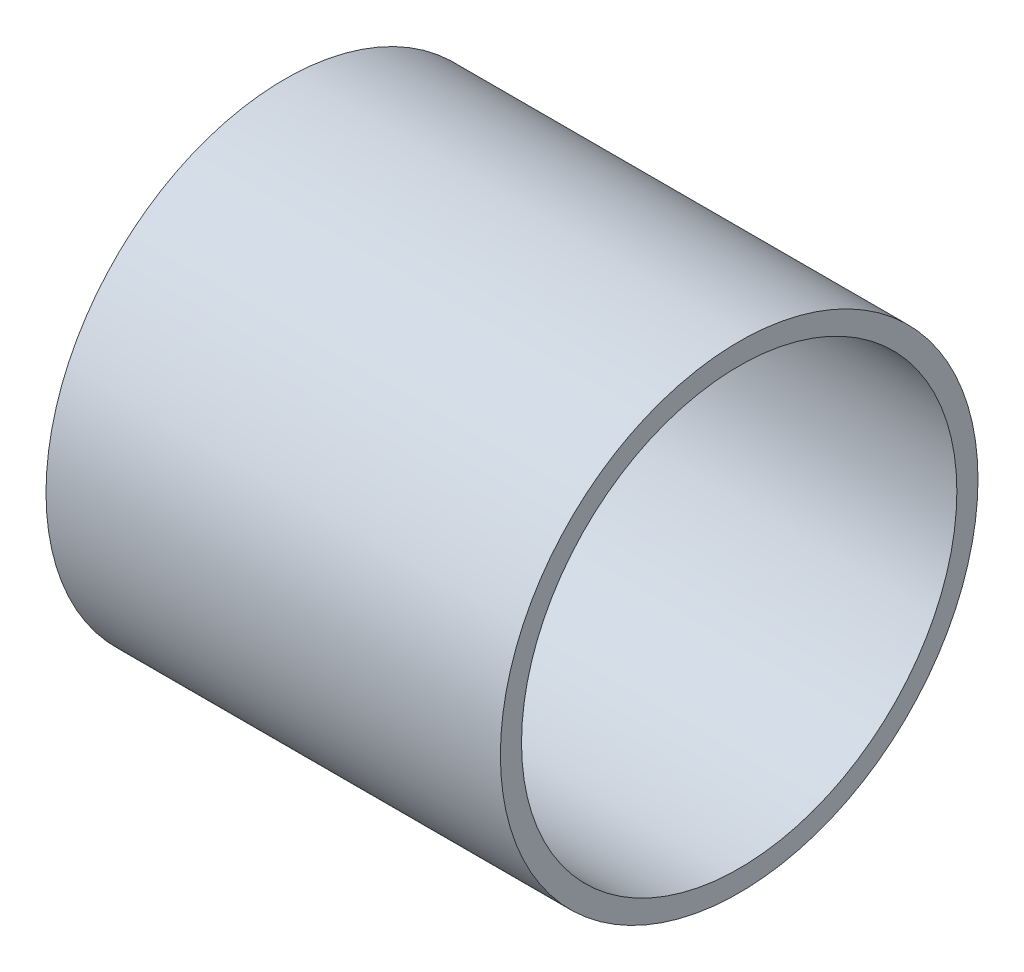
from build123d import *

# Parameters (mm, degrees)
SKIZZE1_R                       = 5.65
SKIZZE1_R_2                     = 5.15
AUFSATZ_LINEAR_AUSTRAGEN1_DEPTH = 10.75


with BuildPart() as part:
    # Skizze1 → Aufsatz-Linear austragen1 (new body)
    with BuildSketch(Plane(origin=(0, 0, 0), x_dir=(0, 0, -1), z_dir=(1, 0, 0))):
        Circle(SKIZZE1_R)
        Circle(SKIZZE1_R_2, mode=Mode.SUBTRACT)
    extrude(amount=AUFSATZ_LINEAR_AUSTRAGEN1_DEPTH)


solid = part.part
